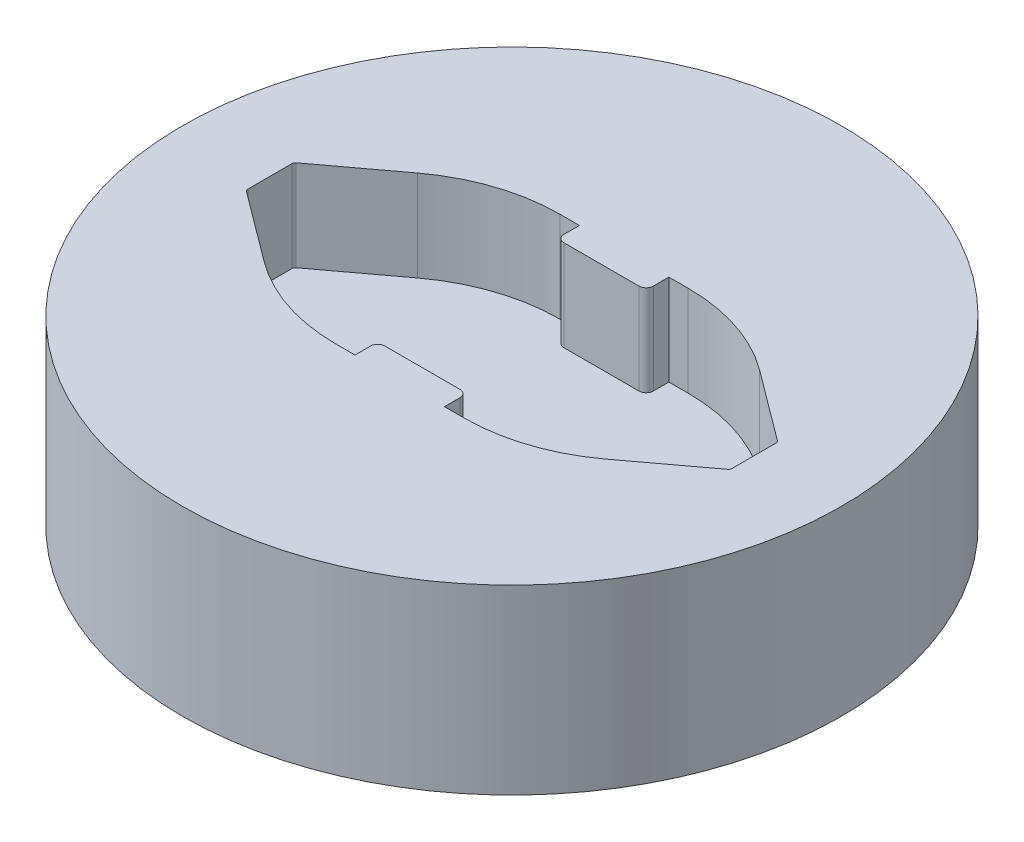
from build123d import *

# Parameters (mm, degrees)
SKETCH1_R           = 92.075
BOSS_EXTRUDE1_DEPTH = 50.8
CUT_EXTRUDE1_DEPTH  = 25.4


with BuildPart() as part:
    # Sketch1 → Boss-Extrude1 (new body)
    with BuildSketch(Plane(origin=(0, 0, 0), x_dir=(1, 0, 0), z_dir=(0, 1, 0))):
        Circle(SKETCH1_R)
    extrude(amount=BOSS_EXTRUDE1_DEPTH)

    # Sketch2 → Cut-Extrude1 (cut)
    with BuildSketch(Plane(origin=(0, 50.8, 0), x_dir=(1, 0, 0), z_dir=(0, 1, 0))):
        with BuildLine():
            Line((-67.611774054, 6.149716593), (-67.611774054, 4.988825845))
            Line((-67.611774054, 4.988825845), (-67.611774054, -4.988825845))
            Line((-67.611774054, -4.988825845), (-67.611774054, -6.149716593))
            ThreePointArc((-67.611774054, -6.149716593), (-67.505615069, -6.598100625), (-67.209677573, -6.95128467))
            Line((-67.209677573, -6.95128467), (-47.801200772, -21.428403847))
            ThreePointArc((-47.801200772, -21.428403847), (-33.655307467, -28.804821632), (-17.906024822, -31.35))
            Line((-17.906024822, -31.35), (-12.5, -31.35))
            Line((-12.5, -31.35), (-12.5, -27))
            ThreePointArc((-12.5, -27), (-11.914213562, -25.585786438), (-10.5, -25))
            Line((-10.5, -25), (-0.667840434, -25))
            Line((-0.667840434, -25), (0.667840434, -25))
            Line((0.667840434, -25), (10.5, -25))
            ThreePointArc((10.5, -25), (11.914213562, -25.585786438), (12.5, -27))
            Line((12.5, -27), (12.5, -31.35))
            Line((12.5, -31.35), (17.906024822, -31.35))
            ThreePointArc((17.906024822, -31.35), (33.655307467, -28.804821632), (47.801200772, -21.428403847))
            Line((47.801200772, -21.428403847), (67.209677573, -6.95128467))
            ThreePointArc((67.209677573, -6.95128467), (67.505615069, -6.598100625), (67.611774054, -6.149716593))
            Line((67.611774054, -6.149716593), (67.611774054, -4.988825845))
            Line((67.611774054, -4.988825845), (67.611774054, 4.988825845))
            Line((67.611774054, 4.988825845), (67.611774054, 6.149716593))
            ThreePointArc((67.611774054, 6.149716593), (67.505615069, 6.598100625), (67.209677573, 6.95128467))
            Line((67.209677573, 6.95128467), (47.801200772, 21.428403847))
            ThreePointArc((47.801200772, 21.428403847), (33.655307467, 28.804821632), (17.906024822, 31.35))
            Line((17.906024822, 31.35), (12.5, 31.35))
            Line((12.5, 31.35), (12.5, 27))
            ThreePointArc((12.5, 27), (11.914213562, 25.585786438), (10.5, 25))
            Line((10.5, 25), (0.667840434, 25))
            Line((0.667840434, 25), (-0.667840434, 25))
            Line((-0.667840434, 25), (-10.5, 25))
            ThreePointArc((-10.5, 25), (-11.914213562, 25.585786438), (-12.5, 27))
            Line((-12.5, 27), (-12.5, 31.35))
            Line((-12.5, 31.35), (-17.906024822, 31.35))
            ThreePointArc((-17.906024822, 31.35), (-33.655307467, 28.804821632), (-47.801200772, 21.428403847))
            Line((-47.801200772, 21.428403847), (-67.209677573, 6.95128467))
            ThreePointArc((-67.209677573, 6.95128467), (-67.505615069, 6.598100625), (-67.611774054, 6.149716593))
        make_face()
    extrude(amount=-CUT_EXTRUDE1_DEPTH, mode=Mode.SUBTRACT)


solid = part.part
